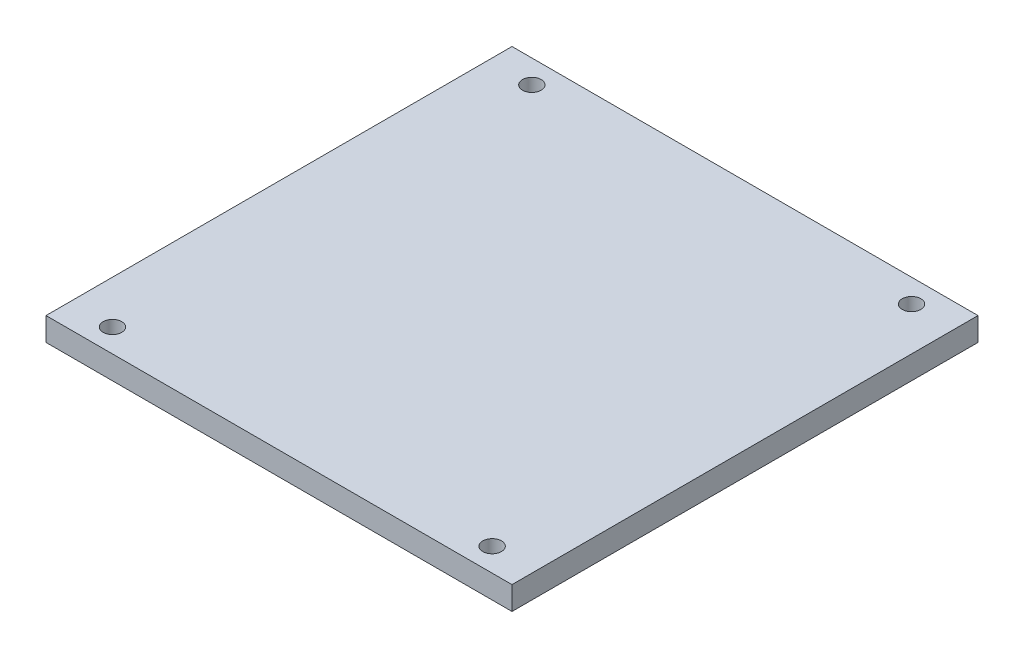
from build123d import *

# Parameters (mm, degrees)
SKETCH1_W           = 127
SKETCH1_H           = 127
BOSS_EXTRUDE1_DEPTH = 6.35
SKETCH3_R           = 2.54
CUT_EXTRUDE2_DEPTH  = 9.525


with BuildPart() as part:
    # Sketch1 → Boss-Extrude1 (new body)
    with BuildSketch(Plane(origin=(0, 0, 0), x_dir=(1, 0, 0), z_dir=(0, 1, 0))):
        Rectangle(SKETCH1_W, SKETCH1_H)
    extrude(amount=BOSS_EXTRUDE1_DEPTH)

    # Sketch3 → Cut-Extrude2 (cut)
    with BuildSketch(Plane(origin=(0, 6.35, 0), x_dir=(1, 0, 0), z_dir=(0, 1, 0))):
        with Locations((-51.738148447, 57.15)):
            Circle(SKETCH3_R)
        with Locations((51.738148447, 57.15)):
            Circle(SKETCH3_R)
        with Locations((-51.738148447, -57.15)):
            Circle(SKETCH3_R)
        with Locations((51.738148447, -57.15)):
            Circle(SKETCH3_R)
    extrude(amount=-CUT_EXTRUDE2_DEPTH, mode=Mode.SUBTRACT)


solid = part.part
